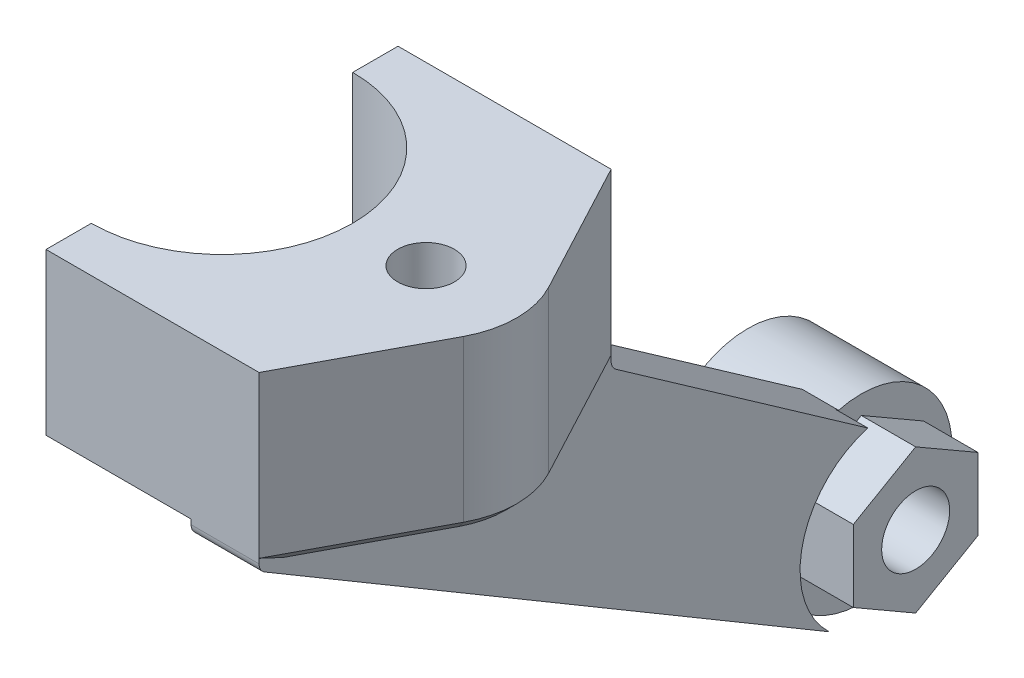
from build123d import *
from build123d.topology import SkipClean

# Parameters (mm, degrees)
SKETCH1_R            = 1.25
BRACKET_DEPTH        = 7.6
SKETCH2_R            = 1.5
ARM_DEPTH            = 1.6
SKETCH3_R            = 1.25
MOUNT_BLIND_DEPTH    = 1
EFFECTOR_START       = -5
SKETCH4_R            = 4
SKETCH4_R_2          = 1.5
EFFECTOR_MOUNT_DEPTH = 5
MOUNT_TRAP_DEPTH     = 2.4
SKETCH6_R            = 1.5
MOUNT_ADAPTOR_DEPTH  = 2.4
SKETCH7_W            = 12.99999996
SKETCH7_H            = 31.965
MIRROR_DELETE_DEPTH  = 37.150933583
ARM_SUPPORT_DEPTH    = 1.4
BODY_CHAMFER_SIZE    = 0.5
ARM_FILLET_R         = 0.5


with BuildPart() as part:
    # Sketch1 → Bracket (new body)
    with BuildSketch(Plane(origin=(0, 0, 0), x_dir=(1, 0, 0), z_dir=(0, 1, 0))):
        with BuildLine():
            Line((0, 7.765), (-9.4, 7.765))
            Line((-9.4, 7.765), (-12.531403257, 1.878614127))
            ThreePointArc((-12.531403257, 1.878614127), (-12.99999996, 0), (-12.531403257, -1.878614127))
            Line((-12.531403257, -1.878614127), (-9.4, -7.765))
            Line((-9.4, -7.765), (0, -7.765))
            Line((0, -7.765), (0, -5.765))
            ThreePointArc((0, -5.765), (-5.765, 0), (0, 5.765))
            Line((0, 5.765), (0, 7.765))
        make_face()
        with Locations(Location((-9, 0, 0), (0, 0, 90))):
            Circle(SKETCH1_R, mode=Mode.SUBTRACT)
    bracket = extrude(amount=BRACKET_DEPTH)

    # Sketch2 → Arm (add)
    with BuildSketch(Plane(origin=(-6.4, 0, 0), x_dir=(0, 0, -1), z_dir=(1, 0, 0))):
        with BuildLine():
            Line((-7.765, 0), (18.162978801, -15.342462002))
            ThreePointArc((18.162978801, -15.342462002), (24.160405232, -12.461418203), (19.2, -8.027016654))
            Line((19.2, -8.027016654), (7.765, 0))
            Line((7.765, 0), (-7.765, 0))
        make_face()
        with Locations((20.2, -11.9)):
            Circle(SKETCH2_R, mode=Mode.SUBTRACT)
    arm = extrude(amount=-ARM_DEPTH)

    # Sketch3 → Mount Blind (add)
    with BuildSketch(Plane.XZ):
        with Locations(Location((-9, 0, 0), (0, 0, 270))):
            Circle(SKETCH3_R)
    mount_blind = extrude(amount=-MOUNT_BLIND_DEPTH)

    # Sketch4 → Effector Mount (add)
    with SkipClean():  # the faces are left unmerged after this step: merging them gives an invalid solid
        with BuildSketch(Plane.ZY.offset(8).offset(EFFECTOR_START)):
            with Locations(Location((-20.2, -11.9, 0), (0, 0, 75.522487814))):
                Circle(SKETCH4_R)
            with Locations(Location((-20.2, -11.9, 0), (0, 0, 180))):
                Circle(SKETCH4_R_2, mode=Mode.SUBTRACT)
        effector_mount = extrude(amount=EFFECTOR_MOUNT_DEPTH)

    # Sketch5 → Mount Trap (cut)
    with SkipClean():  # the faces are left unmerged after this step: merging them gives an invalid solid
        with BuildSketch(Plane(origin=(-3, 0, 0), x_dir=(0, 0, -1), z_dir=(1, 0, 0))):
            Polygon((20.2, -8.724573519), (17.45, -10.31228676), (17.45, -13.48771324), (20.2, -15.075426481), (22.95, -13.48771324), (22.95, -10.31228676), align=None)
        mount_trap = extrude(amount=-MOUNT_TRAP_DEPTH, mode=Mode.SUBTRACT)

    # Sketch6 → Mount Adaptor (add)
    with SkipClean():  # the faces are left unmerged after this step: merging them gives an invalid solid
        with BuildSketch(Plane.ZY.offset(8)):
            Polygon((-17.45, -10.31228676), (-20.2, -8.724573519), (-22.95, -10.31228676), (-22.95, -13.48771324), (-20.2, -15.075426481), (-17.45, -13.48771324), align=None)
            with Locations(Location((-20.2, -11.9, 0), (0, 0, 180))):
                Circle(SKETCH6_R, mode=Mode.SUBTRACT)
        mount_adaptor = extrude(amount=MOUNT_ADAPTOR_DEPTH)

    # Mirror 2: Bracket, Arm, Mount Blind, Effector Mount, Mount Trap, Mount Adaptor across plane
    with SkipClean():  # the faces are left unmerged after this step: merging them gives an invalid solid
        add(bracket.mirror(Plane(origin=(0, 0, 0), x_dir=(0, 0, 1), z_dir=(1, 0, 0))))
        add(arm.mirror(Plane(origin=(0, 0, 0), x_dir=(0, 0, 1), z_dir=(1, 0, 0))))
        add(mount_blind.mirror(Plane(origin=(0, 0, 0), x_dir=(0, 0, 1), z_dir=(1, 0, 0))))
        add(effector_mount.mirror(Plane(origin=(0, 0, 0), x_dir=(0, 0, 1), z_dir=(1, 0, 0))))
        add(mount_trap.mirror(Plane(origin=(0, 0, 0), x_dir=(0, 0, 1), z_dir=(1, 0, 0))), mode=Mode.SUBTRACT)
        add(mount_adaptor.mirror(Plane(origin=(0, 0, 0), x_dir=(0, 0, 1), z_dir=(1, 0, 0))))

    # Sketch7 → Mirror Delete (cut, through all)
    with SkipClean():  # the faces are left unmerged after this step: merging them gives an invalid solid
        with BuildSketch(Plane(origin=(0, 7.6, 0), x_dir=(1, 0, 0), z_dir=(0, 1, 0))):
            with Locations((-6.49999998, 8.2175)):
                Rectangle(SKETCH7_W, SKETCH7_H)
        extrude(amount=-MIRROR_DELETE_DEPTH, mode=Mode.SUBTRACT)

    # Sketch8 → Arm Support (add)
    with SkipClean():  # the faces are left unmerged after this step: merging them gives an invalid solid
        with BuildSketch(Plane(origin=(8, 0, 0), x_dir=(0, 0, -1), z_dir=(1, 0, 0))):
            with BuildLine():
                Line((7.765, 0), (19.093373314, -7.952168015))
                ThreePointArc((19.093373314, -7.952168015), (16.218654953, -10.920769884), (17.388424851, -14.884132232))
                Line((17.388424851, -14.884132232), (-7.765, 0))
                Line((-7.765, 0), (7.765, 0))
            make_face()
        extrude(amount=ARM_SUPPORT_DEPTH)

    # Body Chamfer
    # the kernel refuses this chamfer: 0.5 mm, written as the material it takes off along each edge
    with BuildSketch(Plane(origin=(8.796100001, 0, -8.90020621), x_dir=(0.024274757051952575, 0.9996219169112968, -0.012913535559763734), z_dir=(0.4696535317878062, 0, 0.8828508141692119))) as body_chamfer_piece_1_section:
        Polygon((BODY_CHAMFER_SIZE * 0.999621916911, BODY_CHAMFER_SIZE * 0.0274958766106), (-BODY_CHAMFER_SIZE * 0.0274958766106, BODY_CHAMFER_SIZE * 0.999621916911), (0, 0), align=None)
    body_chamfer_piece_1 = extrude(amount=7.953316653, mode=Mode.PRIVATE)
    body_chamfer_piece_1 = split(body_chamfer_piece_1, bisect_by=Plane(origin=(9.4, 0.324892832, -7.480239841), z_dir=(1, 0, 0)), keep=Keep.TOP, mode=Mode.PRIVATE)
    add(body_chamfer_piece_1, mode=Mode.SUBTRACT)
    with BuildSketch(Plane(origin=(8.999999655, 0, 0), x_dir=(0.8828508331840651, 0, -0.4696534960438411), z_dir=(-0.4696534960438411, 0, -0.8828508331840651))) as body_chamfer_piece_2:
        Polygon((4.000000304, -BODY_CHAMFER_SIZE), (4.000000304 - BODY_CHAMFER_SIZE, 0), (4.000000304, 0), align=None)
    revolve(axis=Axis((8.999999655, 0, 0), (0, -1, 0)), revolution_arc=56.023613132, mode=Mode.SUBTRACT)
    with BuildSketch(Plane(origin=(12.531403257, 0, 1.878614127), x_dir=(0.02427475705195258, 0.9996219169112968, 0.012913535559763729), z_dir=(-0.46965353178780606, 0, 0.8828508141692119))) as body_chamfer_piece_3_section:
        Polygon((BODY_CHAMFER_SIZE * 0.999621916911, BODY_CHAMFER_SIZE * 0.0274958766106), (-BODY_CHAMFER_SIZE * 0.0274958766106, BODY_CHAMFER_SIZE * 0.999621916911), (0, 0), align=None)
    body_chamfer_piece_3 = extrude(amount=7.953316653, mode=Mode.PRIVATE)
    body_chamfer_piece_3 = split(body_chamfer_piece_3, bisect_by=Plane(origin=(9.4, 0.173767424, 5.065126353), z_dir=(1, 0, 0)), keep=Keep.TOP, mode=Mode.PRIVATE)
    add(body_chamfer_piece_3, mode=Mode.SUBTRACT)
    with BuildSketch(Plane(origin=(6.4, 0, 7.765), x_dir=(0, -0.02749587661058639, -0.9996219169112968), z_dir=(-1, 0, 0)), Plane(origin=(-1.285841494, 0, -7.765), x_dir=(0, -0.02749587661058639, 0.9996219169112968), z_dir=(1, 0, 0))) as body_chamfer_piece_4:
        Polygon((BODY_CHAMFER_SIZE * 0.999621916911, -BODY_CHAMFER_SIZE * 0.0274958766106), (-BODY_CHAMFER_SIZE * 0.0274958766106, -BODY_CHAMFER_SIZE * 0.999621916911), (0, 0), align=None)
    extrude(amount=7.685841494, mode=Mode.SUBTRACT)
    with BuildSketch(Plane(origin=(10.693671764, 0, 7.765), x_dir=(0, 0.9998167148671796, 0.019145147484436967), z_dir=(-1, 0, 0))) as body_chamfer_piece_5_section:
        Polygon((BODY_CHAMFER_SIZE * 0.999816714867, BODY_CHAMFER_SIZE * 0.0191451474844), (-BODY_CHAMFER_SIZE * 0.52563857146, BODY_CHAMFER_SIZE * 0.850707994669), (0, 0), align=None)
    body_chamfer_piece_5 = extrude(amount=2.693671764, mode=Mode.PRIVATE)
    body_chamfer_piece_5 = split(body_chamfer_piece_5, bisect_by=Plane(origin=(9.4, 0.125, 7.622443684), z_dir=(1, 0, 0)), keep=Keep.TOP, mode=Mode.PRIVATE)
    add(body_chamfer_piece_5, mode=Mode.SUBTRACT)

    # Arm Fillet
    arm_fillet_edges = [part.edges().sort_by_distance(p)[0] for p in [
        (7.2, 0, -7.765),
        (7.2, 0, 7.765),
    ]]
    fillet(arm_fillet_edges, radius=ARM_FILLET_R)


solid = part.part
